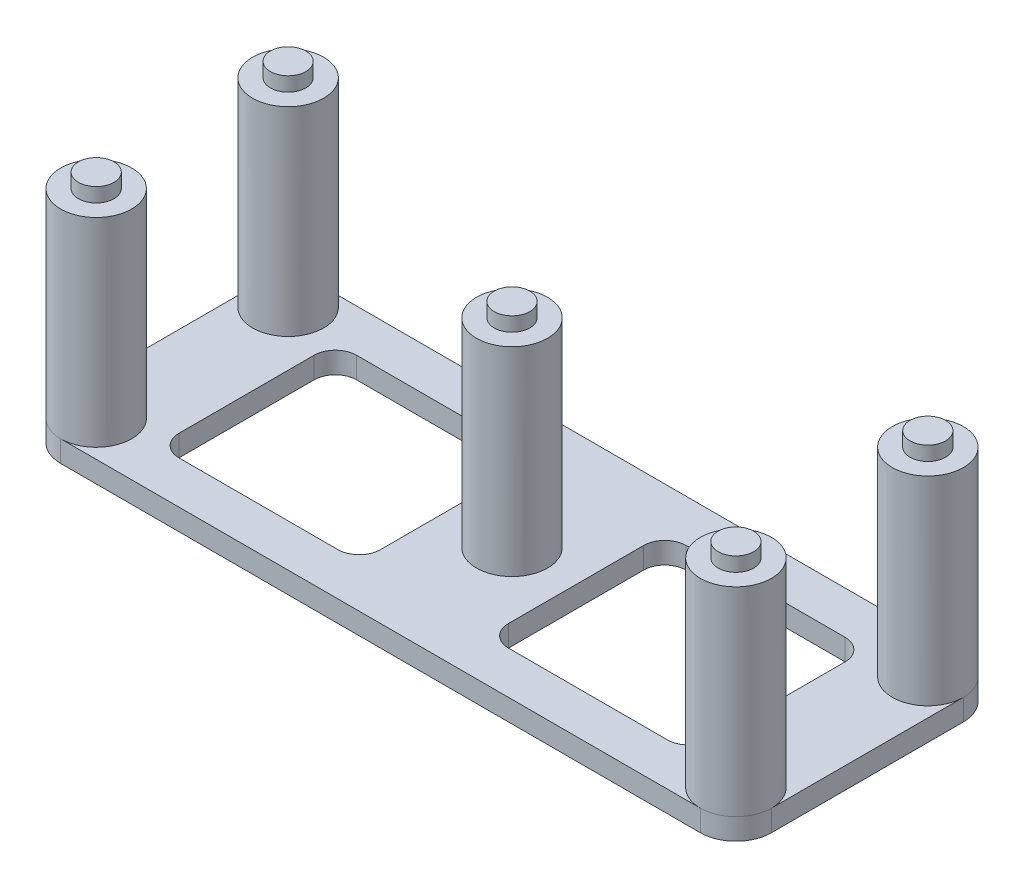
from build123d import *

# Parameters (mm, degrees)
SKETCH1_W           = 100
SKETCH1_H           = 37
BOSS_EXTRUDE1_DEPTH = 1.5
SKETCH2_R           = 5
BOSS_EXTRUDE2_DEPTH = 28
SKETCH3_R           = 2.5
BOSS_EXTRUDE3_DEPTH = 2
CUT_EXTRUDE1_REACH  = 63.174
SKETCH4_W           = 28.35810721
SKETCH4_H           = 25
FILLET1_R           = 3
FILLET4_R           = 5


with BuildPart() as part:
    # Sketch1 → Boss-Extrude1 (new, symmetric)
    with BuildSketch(Plane(origin=(0, 0, 0), x_dir=(1, 0, 0), z_dir=(0, 1, 0))):
        Rectangle(SKETCH1_W, SKETCH1_H)
    extrude(amount=BOSS_EXTRUDE1_DEPTH, both=True)

    # Sketch2 → Boss-Extrude2 (add)
    with BuildSketch(Plane(origin=(0, 1.5, 0), x_dir=(1, 0, 0), z_dir=(0, 1, 0))):
        with Locations((-45, 13.5)):
            Circle(SKETCH2_R)
        with Locations((45, 13.5)):
            Circle(SKETCH2_R)
        with Locations((45, -13.5)):
            Circle(SKETCH2_R)
        with Locations((-45, -13.5)):
            Circle(SKETCH2_R)
        Circle(SKETCH2_R)
    extrude(amount=BOSS_EXTRUDE2_DEPTH)

    # Sketch3 → Boss-Extrude3 (add)
    with BuildSketch(Plane(origin=(0, 29.5, 0), x_dir=(1, 0, 0), z_dir=(0, 1, 0))):
        with Locations((-45, 13.5)):
            Circle(SKETCH3_R)
        with Locations((45, 13.5)):
            Circle(SKETCH3_R)
        with Locations((45, -13.5)):
            Circle(SKETCH3_R)
        with Locations((-45, -13.5)):
            Circle(SKETCH3_R)
        Circle(SKETCH3_R)
    extrude(amount=BOSS_EXTRUDE3_DEPTH)

    # Sketch4 → Cut-Extrude1 (cut, up to next)
    with BuildSketch(Plane(origin=(0, 1.5, 0), x_dir=(1, 0, 0), z_dir=(0, 1, 0)), mode=Mode.PRIVATE) as cut_extrude1_sk1:
        with Locations((-23.179053605, 0)):
            Rectangle(SKETCH4_W, SKETCH4_H)
    cut_extrude1_tool1 = extrude(cut_extrude1_sk1.sketch, amount=-CUT_EXTRUDE1_REACH, mode=Mode.PRIVATE) & part.part
    # Sketch4 → Cut-Extrude1 (cut, up to next)
    with BuildSketch(Plane(origin=(0, 1.5, 0), x_dir=(1, 0, 0), z_dir=(0, 1, 0)), mode=Mode.PRIVATE) as cut_extrude1_sk2:
        with Locations((23.179053605, 0)):
            Rectangle(SKETCH4_W, SKETCH4_H)
    cut_extrude1_tool2 = extrude(cut_extrude1_sk2.sketch, amount=-CUT_EXTRUDE1_REACH, mode=Mode.PRIVATE) & part.part
    add(cut_extrude1_tool1.solids().sort_by_distance((-23.179054, 1.5, 0))[0], mode=Mode.SUBTRACT)
    add(cut_extrude1_tool2.solids().sort_by_distance((23.179054, 1.5, 0))[0], mode=Mode.SUBTRACT)

    # Fillet1
    fillet1_edges = [part.edges().sort_by_distance(p)[0] for p in [
        (37.35810721, 0, 12.5),
        (37.35810721, 0, -12.5),
        (9, 0, -12.5),
        (9, 0, 12.5),
        (-37.35810721, 0, 12.5),
        (-9, 0, 12.5),
        (-9, 0, -12.5),
        (-37.35810721, 0, -12.5),
    ]]
    fillet(fillet1_edges, radius=FILLET1_R)

    # Fillet4
    fillet4_edges = [part.edges().sort_by_distance(p)[0] for p in [
        (50, 0, 18.5),
        (-50, 0, -18.5),
        (-50, 0, 18.5),
        (50, 0, -18.5),
    ]]
    fillet(fillet4_edges, radius=FILLET4_R)


solid = part.part
